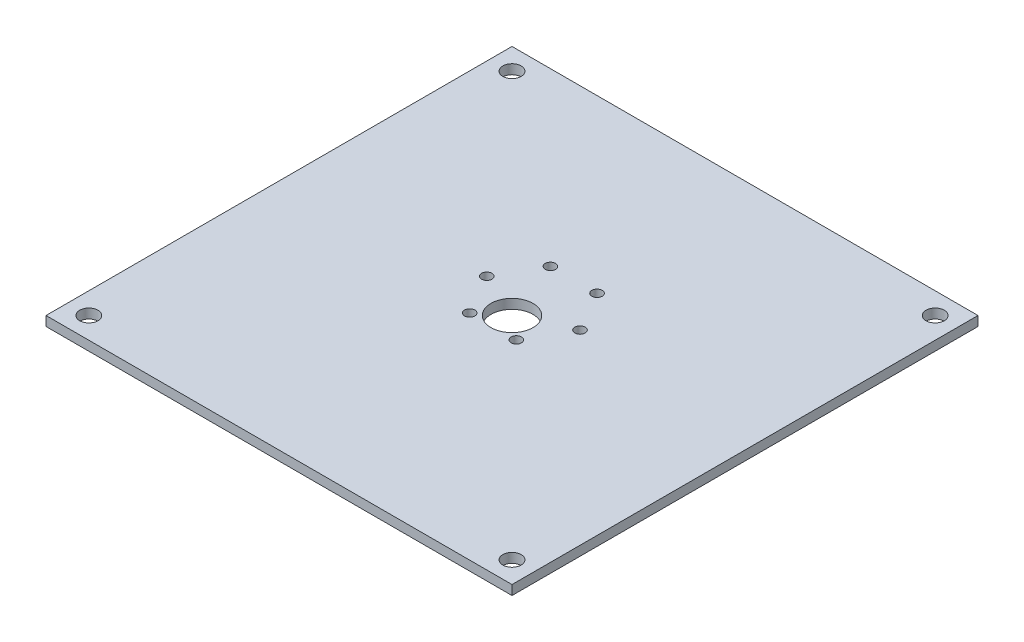
from build123d import *

# Parameters (mm, degrees)
SKETCH1_W           = 154.94
SKETCH1_H           = 154.94
SKETCH1_R           = 3.04
SKETCH1_R_2         = 1.72
SKETCH1_R_3         = 6.985
BOSS_EXTRUDE1_DEPTH = 1.5875


with BuildPart() as part:
    # Sketch1 → Boss-Extrude1 (new, symmetric)
    with BuildSketch(Plane(origin=(0, 0, 0), x_dir=(1, 0, 0), z_dir=(0, 1, 0))):
        Rectangle(SKETCH1_W, SKETCH1_H)
        with Locations((-70.35005366, -70.35005366)):
            Circle(SKETCH1_R, mode=Mode.SUBTRACT)
        with Locations((-7.747, -6.306197606)):
            Circle(SKETCH1_R_2, mode=Mode.SUBTRACT)
        with Locations((70.35005366, -70.35005366)):
            Circle(SKETCH1_R, mode=Mode.SUBTRACT)
        with Locations((7.747, -6.306197606)):
            Circle(SKETCH1_R_2, mode=Mode.SUBTRACT)
        with Locations((-15.494, 7.112)):
            Circle(SKETCH1_R_2, mode=Mode.SUBTRACT)
        with Locations((-7.747, 20.530197606)):
            Circle(SKETCH1_R_2, mode=Mode.SUBTRACT)
        with Locations((-70.35005366, 70.35005366)):
            Circle(SKETCH1_R, mode=Mode.SUBTRACT)
        Circle(SKETCH1_R_3, mode=Mode.SUBTRACT)
        with Locations((15.494, 7.112)):
            Circle(SKETCH1_R_2, mode=Mode.SUBTRACT)
        with Locations((7.747, 20.530197606)):
            Circle(SKETCH1_R_2, mode=Mode.SUBTRACT)
        with Locations((70.35005366, 70.35005366)):
            Circle(SKETCH1_R, mode=Mode.SUBTRACT)
    extrude(amount=BOSS_EXTRUDE1_DEPTH, both=True)


solid = part.part
